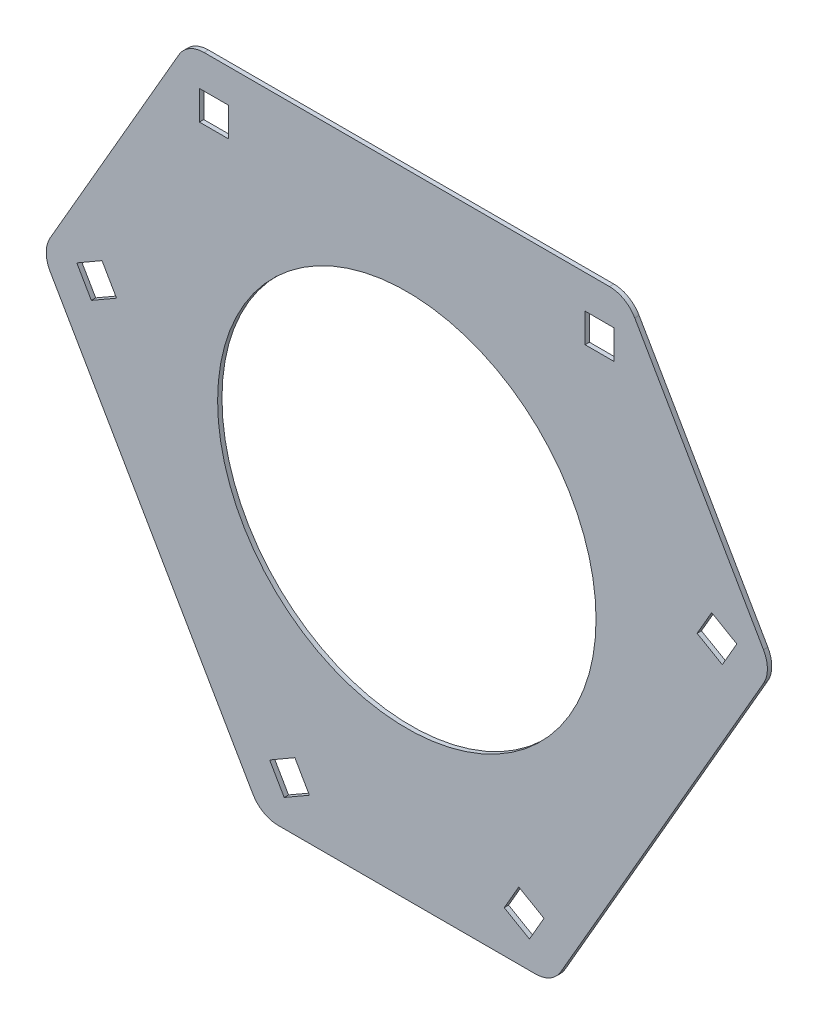
from build123d import *

# Parameters (mm, degrees)
SKETCH_1_R          = 130
EXTRUDE_1_DEPTH     = 3
SKETCH_8_W          = 20
SKETCH_8_H          = 20
CUT_EXTRUDE_4_DEPTH = 342.614056427
FILLET_2_R          = 20


with BuildPart() as part:
    # 草图1 → 凸台-拉伸1 (new body)
    with BuildSketch(Plane.XY):
        Polygon((150.828607906, 202.550991214), (-150.828607906, 202.550991214), (-250.828607906, 29.345910457), (-100, -231.89690167), (100, -231.89690167), (250.828607906, 29.345910457), align=None)
        Circle(SKETCH_1_R, mode=Mode.SUBTRACT)
    extrude(amount=EXTRUDE_1_DEPTH)

    # 草图8 → 切除-拉伸4 (cut, through all)
    with BuildSketch(Plane.XY.offset(3)):
        with Locations((-132.5, 169.550991214)):
            Rectangle(SKETCH_8_W, SKETCH_8_H)
        Polygon((-209.42521159, 43.633124432), (-226.745719666, 33.633124432), (-216.745719666, 16.312616357), (-199.42521159, 26.312616357), align=None)
        Polygon((-84.245719666, -213.184115646), (-66.92521159, -203.184115646), (-76.92521159, -185.86360757), (-94.245719666, -195.86360757), align=None)
        Polygon((66.92521159, -203.184115646), (84.245719666, -213.184115646), (94.245719666, -195.86360757), (76.92521159, -185.86360757), align=None)
        Polygon((209.42521159, 43.633124432), (199.42521159, 26.312616357), (216.745719666, 16.312616357), (226.745719666, 33.633124432), align=None)
        with Locations((132.5, 169.550991214)):
            Rectangle(SKETCH_8_W, SKETCH_8_H)
    extrude(amount=-CUT_EXTRUDE_4_DEPTH, mode=Mode.SUBTRACT)

    # 圆角2
    fillet_2_edges = [part.edges().sort_by_distance(p)[0] for p in [
        (100, -231.89690167, 1.5),
        (-100, -231.89690167, 1.5),
        (150.828607906, 202.550991214, 1.5),
        (250.828607906, 29.345910457, 1.5),
        (-250.828607906, 29.345910457, 1.5),
        (-150.828607906, 202.550991214, 1.5),
    ]]
    fillet(fillet_2_edges, radius=FILLET_2_R)


solid = part.part
